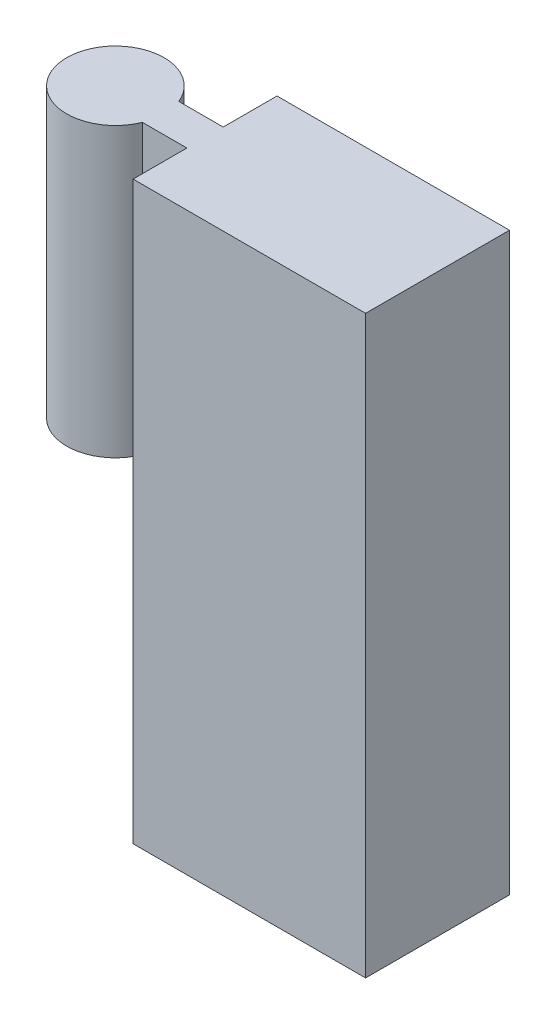
from build123d import *

# Parameters (mm, degrees)
SZKIC1_W                    = 10.5
SZKIC1_H                    = 26
DODANIE_WYCI_GNI_CIE1_DEPTH = 6.5
DODANIE_WYCI_GNI_CIE2_DEPTH = 13


with BuildPart() as part:
    # Szkic1 → Dodanie-wyciągnięcie1 (new body)
    with BuildSketch(Plane.XY):
        Rectangle(SZKIC1_W, SZKIC1_H)
    extrude(amount=DODANIE_WYCI_GNI_CIE1_DEPTH)

    # Szkic3 → Dodanie-wyciągnięcie2 (add)
    with BuildSketch(Plane(origin=(0, 13, 0), x_dir=(1, 0, 0), z_dir=(0, 1, 0))):
        with BuildLine():
            Line((-7.258694583, -4.070409772), (-5.25, -4.070409772))
            Line((-5.25, -4.070409772), (-5.25, -2.429590228))
            Line((-5.25, -2.429590228), (-7.258694583, -2.429590228))
            ThreePointArc((-7.258694583, -2.429590228), (-11.5, -3.25), (-7.258694583, -4.070409772))
        make_face()
    extrude(amount=-DODANIE_WYCI_GNI_CIE2_DEPTH)


solid = part.part
